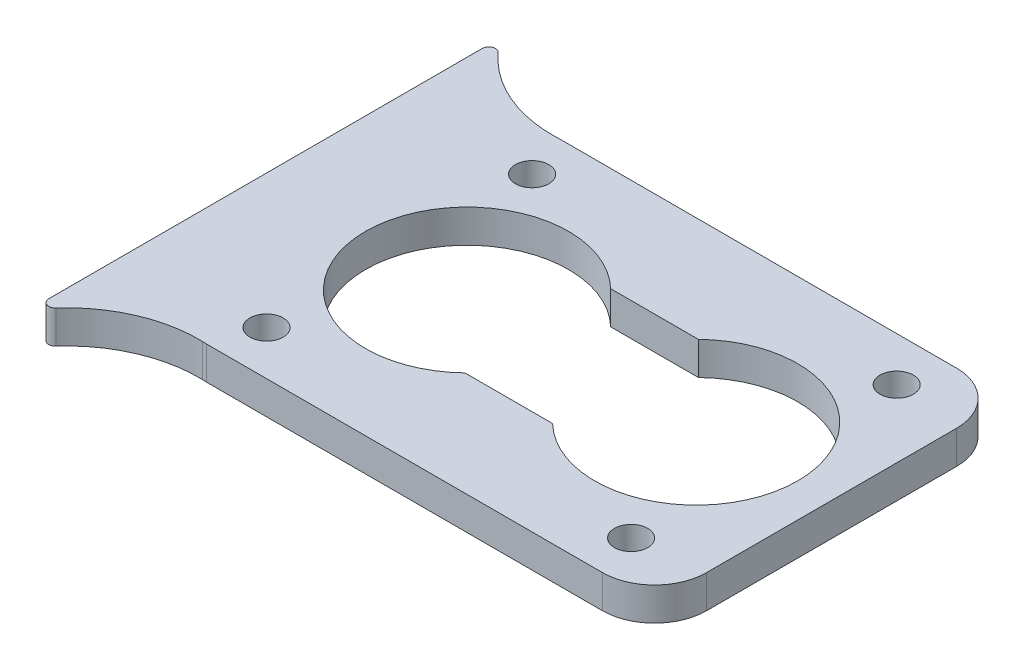
from build123d import *

# Parameters (mm, degrees)
BOSS_EXTRUDE1_DEPTH = 3.175
BOSS_EXTRUDE2_DEPTH = 3.175
FILLET1_R           = 0.635


with BuildPart() as part:
    # Sketch1 → Boss-Extrude1 (new body)
    with BuildSketch(Plane(origin=(0, 0, 0), x_dir=(1, 0, 0), z_dir=(0, 1, 0))):
        with BuildLine():
            Line((-157.73462252, 34.703486642), (-119.73462252, 34.703486642))
            ThreePointArc((-119.73462252, 34.703486642), (-116.199088614, 36.167952736), (-114.73462252, 39.703486642))
            Line((-114.73462252, 39.703486642), (-114.73462252, 63.703486642))
            ThreePointArc((-114.73462252, 63.703486642), (-116.199088614, 67.239020548), (-119.73462252, 68.703486642))
            Line((-119.73462252, 68.703486642), (-157.73462252, 68.703486642))
            ThreePointArc((-157.73462252, 68.703486642), (-161.270156426, 67.239020548), (-162.73462252, 63.703486642))
            Line((-162.73462252, 63.703486642), (-162.73462252, 39.703486642))
            ThreePointArc((-162.73462252, 39.703486642), (-161.270156426, 36.167952736), (-157.73462252, 34.703486642))
        make_face()
        with BuildLine():
            Line((-134.5215585, 44.703486642), (-142.94768654, 44.703486642))
            ThreePointArc((-142.94768654, 44.703486642), (-146.073167891, 42.667101856), (-149.73462252, 41.953486642))
            ThreePointArc((-149.73462252, 41.953486642), (-159.48462252, 51.703486642), (-149.73462252, 61.453486642))
            ThreePointArc((-149.73462252, 61.453486642), (-146.073167891, 60.739871428), (-142.94768654, 58.703486642))
            Line((-142.94768654, 58.703486642), (-134.5215585, 58.703486642))
            ThreePointArc((-134.5215585, 58.703486642), (-131.396077149, 60.739871428), (-127.73462252, 61.453486642))
            ThreePointArc((-127.73462252, 61.453486642), (-117.98462252, 51.703486642), (-127.73462252, 41.953486642))
            ThreePointArc((-127.73462252, 41.953486642), (-131.396077149, 42.667101856), (-134.5215585, 44.703486642))
        make_face(mode=Mode.SUBTRACT)
        with BuildLine():
            ThreePointArc((-121.23462252, 37.353486642), (-119.63462252, 38.953486642), (-121.23462252, 40.553486642))
            ThreePointArc((-121.23462252, 40.553486642), (-122.83462252, 38.953486642), (-121.23462252, 37.353486642))
        make_face(mode=Mode.SUBTRACT)
        with BuildLine():
            ThreePointArc((-156.23462252, 37.353486642), (-154.63462252, 38.953486642), (-156.23462252, 40.553486642))
            ThreePointArc((-156.23462252, 40.553486642), (-157.83462252, 38.953486642), (-156.23462252, 37.353486642))
        make_face(mode=Mode.SUBTRACT)
        with BuildLine():
            ThreePointArc((-156.23462252, 62.853486642), (-154.63462252, 64.453486642), (-156.23462252, 66.053486642))
            ThreePointArc((-156.23462252, 66.053486642), (-157.83462252, 64.453486642), (-156.23462252, 62.853486642))
        make_face(mode=Mode.SUBTRACT)
        with BuildLine():
            ThreePointArc((-121.23462252, 62.853486642), (-119.63462252, 64.453486642), (-121.23462252, 66.053486642))
            ThreePointArc((-121.23462252, 66.053486642), (-122.83462252, 64.453486642), (-121.23462252, 62.853486642))
        make_face(mode=Mode.SUBTRACT)
    extrude(amount=BOSS_EXTRUDE1_DEPTH)

    # Sketch2 → Boss-Extrude2 (add)
    with BuildSketch(Plane.XZ):
        with BuildLine():
            Line((-169.08462252, -29.024879137), (-169.08462252, -74.382094147))
            ThreePointArc((-169.08462252, -74.382094147), (-164.359232711, -70.120144783), (-158.159635896, -68.685390257))
            ThreePointArc((-158.159635896, -68.685390257), (-161.417357026, -67.085419013), (-162.73462252, -63.703486642))
            Line((-162.73462252, -63.703486642), (-162.73462252, -39.703486642))
            ThreePointArc((-162.73462252, -39.703486642), (-161.417357026, -36.321554271), (-158.159635896, -34.721583027))
            ThreePointArc((-158.159635896, -34.721583027), (-164.359232711, -33.286828501), (-169.08462252, -29.024879137))
        make_face()
    extrude(amount=-BOSS_EXTRUDE2_DEPTH)

    # Fillet1
    fillet1_edges = [part.edges().sort_by_distance(p)[0] for p in [
        (-169.08462252, 1.5875, -29.024879137),
        (-169.08462252, 1.5875, -74.382094147),
    ]]
    fillet(fillet1_edges, radius=FILLET1_R)


solid = part.part
